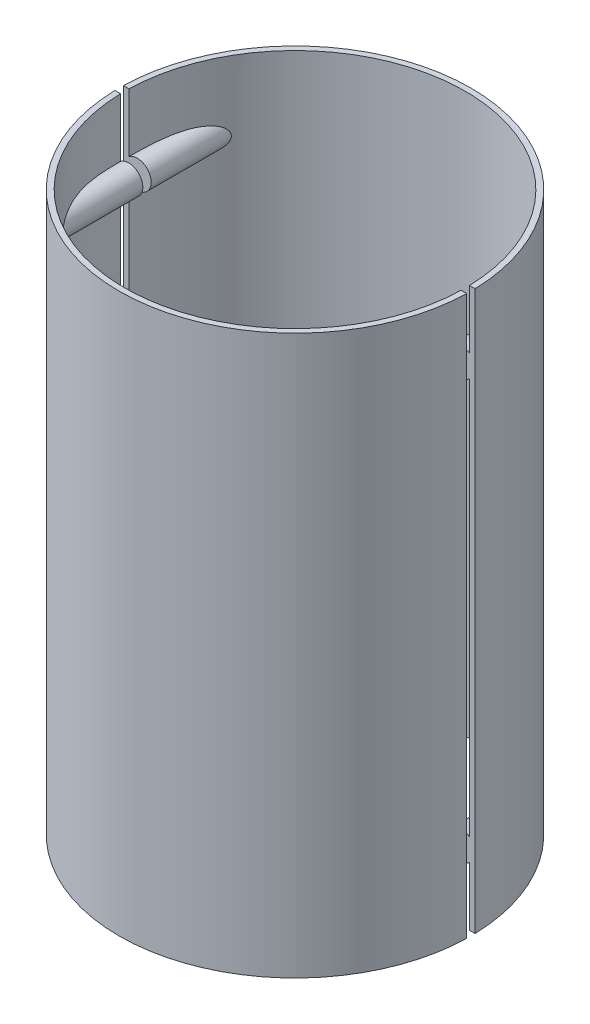
from build123d import *

# Parameters (mm, degrees)
SKETCH1_W                            = 63
SKETCH1_H                            = 200
SHELL1_T                             = -2
BOSS_EXTRUDE1_REACH                  = 135.933
BOSS_EXTRUDE1_END_RADIUS             = 61
SKETCH3_R                            = 5
BOSS_EXTRUDE1_DIRECTION_2_REACH      = 135.933
BOSS_EXTRUDE1_DIRECTION_2_END_RADIUS = 61
SKETCH2_W                            = 126
SKETCH2_H                            = 200
CUT_EXTRUDE1_DEPTH                   = 1.5


with BuildPart() as part:
    # Sketch1 → Revolve1 (revolve)
    with BuildSketch(Plane.XY):
        with Locations((31.5, 0)):
            Rectangle(SKETCH1_W, SKETCH1_H)
    revolve(axis=Axis((0, 52.891355973, 0), (0, -1, 0)))

    # Shell1
    shell1_openings = [part.faces().sort_by_distance(p)[0] for p in [
        (0, -100, 0),
        (0, 100, 0),
    ]]
    offset(amount=SHELL1_T, openings=shell1_openings, kind=Kind.INTERSECTION)

    # Boss-Extrude1: up to this cylinder (the profile starts inside it)
    boss_extrude1_end = Plane(origin=(0, 0, 0), z_dir=(0, 1, 0)) * Cylinder(BOSS_EXTRUDE1_END_RADIUS, 544.866, mode=Mode.PRIVATE)
    # Sketch3 → Boss-Extrude1 (add, up to the surface)
    with BuildSketch(Plane.XY, mode=Mode.PRIVATE) as boss_extrude1_sk1:
        with Locations((-58, 75)):
            Circle(SKETCH3_R)
    boss_extrude1_tool1 = extrude(boss_extrude1_sk1.sketch, amount=BOSS_EXTRUDE1_REACH, mode=Mode.PRIVATE) & boss_extrude1_end
    add(boss_extrude1_tool1.solids().sort_by_distance((-58, 75, 0))[0])
    # Sketch3 → Boss-Extrude1 (add, up to the surface)
    with BuildSketch(Plane.XY, mode=Mode.PRIVATE) as boss_extrude1_sk2:
        with Locations((58, -75)):
            Circle(SKETCH3_R)
    boss_extrude1_tool2 = extrude(boss_extrude1_sk2.sketch, amount=BOSS_EXTRUDE1_REACH, mode=Mode.PRIVATE) & boss_extrude1_end
    add(boss_extrude1_tool2.solids().sort_by_distance((58, -75, 0))[0])
    # Sketch3 → Boss-Extrude1 (add, up to the surface)
    with BuildSketch(Plane.XY, mode=Mode.PRIVATE) as boss_extrude1_sk3:
        with Locations((-58, -75)):
            Circle(SKETCH3_R)
    boss_extrude1_tool3 = extrude(boss_extrude1_sk3.sketch, amount=BOSS_EXTRUDE1_REACH, mode=Mode.PRIVATE) & boss_extrude1_end
    add(boss_extrude1_tool3.solids().sort_by_distance((-58, -75, 0))[0])
    # Sketch3 → Boss-Extrude1 (add, up to the surface)
    with BuildSketch(Plane.XY, mode=Mode.PRIVATE) as boss_extrude1_sk4:
        with Locations((58, 75)):
            Circle(SKETCH3_R)
    boss_extrude1_tool4 = extrude(boss_extrude1_sk4.sketch, amount=BOSS_EXTRUDE1_REACH, mode=Mode.PRIVATE) & boss_extrude1_end
    add(boss_extrude1_tool4.solids().sort_by_distance((58, 75, 0))[0])

    # Boss-Extrude1 direction 2: up to this cylinder (the profile starts inside it)
    boss_extrude1_direction_2_end = Plane(origin=(0, 0, 0), z_dir=(0, 1, 0)) * Cylinder(BOSS_EXTRUDE1_DIRECTION_2_END_RADIUS, 544.866, mode=Mode.PRIVATE)
    # Sketch3 → Boss-Extrude1 direction 2 (add, up to the surface)
    with BuildSketch(Plane.XY, mode=Mode.PRIVATE) as boss_extrude1_direction_2_sk1:
        with Locations((-58, 75)):
            Circle(SKETCH3_R)
    boss_extrude1_direction_2_tool1 = extrude(boss_extrude1_direction_2_sk1.sketch, amount=-BOSS_EXTRUDE1_DIRECTION_2_REACH, mode=Mode.PRIVATE) & boss_extrude1_direction_2_end
    add(boss_extrude1_direction_2_tool1.solids().sort_by_distance((-58, 75, 0))[0])
    # Sketch3 → Boss-Extrude1 direction 2 (add, up to the surface)
    with BuildSketch(Plane.XY, mode=Mode.PRIVATE) as boss_extrude1_direction_2_sk2:
        with Locations((58, -75)):
            Circle(SKETCH3_R)
    boss_extrude1_direction_2_tool2 = extrude(boss_extrude1_direction_2_sk2.sketch, amount=-BOSS_EXTRUDE1_DIRECTION_2_REACH, mode=Mode.PRIVATE) & boss_extrude1_direction_2_end
    add(boss_extrude1_direction_2_tool2.solids().sort_by_distance((58, -75, 0))[0])
    # Sketch3 → Boss-Extrude1 direction 2 (add, up to the surface)
    with BuildSketch(Plane.XY, mode=Mode.PRIVATE) as boss_extrude1_direction_2_sk3:
        with Locations((-58, -75)):
            Circle(SKETCH3_R)
    boss_extrude1_direction_2_tool3 = extrude(boss_extrude1_direction_2_sk3.sketch, amount=-BOSS_EXTRUDE1_DIRECTION_2_REACH, mode=Mode.PRIVATE) & boss_extrude1_direction_2_end
    add(boss_extrude1_direction_2_tool3.solids().sort_by_distance((-58, -75, 0))[0])
    # Sketch3 → Boss-Extrude1 direction 2 (add, up to the surface)
    with BuildSketch(Plane.XY, mode=Mode.PRIVATE) as boss_extrude1_direction_2_sk4:
        with Locations((58, 75)):
            Circle(SKETCH3_R)
    boss_extrude1_direction_2_tool4 = extrude(boss_extrude1_direction_2_sk4.sketch, amount=-BOSS_EXTRUDE1_DIRECTION_2_REACH, mode=Mode.PRIVATE) & boss_extrude1_direction_2_end
    add(boss_extrude1_direction_2_tool4.solids().sort_by_distance((58, 75, 0))[0])

    # Sketch2 → Cut-Extrude1 (cut, symmetric)
    with BuildSketch(Plane.XY):
        Rectangle(SKETCH2_W, SKETCH2_H)
    extrude(amount=CUT_EXTRUDE1_DEPTH, both=True, mode=Mode.SUBTRACT)


with BuildPart() as cut_extrude1_piece_1:
    # of the separate pieces the step leaves, piece 1, a body of its own (cut_extrude1_pieces)
    add(part.part.solids().sort_by_distance((-62.982140326, -100, -1.5))[0])


with BuildPart() as cut_extrude1_piece_2:
    # of the separate pieces the step leaves, piece 2, a body of its own (cut_extrude1_pieces)
    add(part.part.solids().sort_by_distance((62.982140326, -100, 1.5))[0])


solid = Compound([cut_extrude1_piece_1.part, cut_extrude1_piece_2.part])
